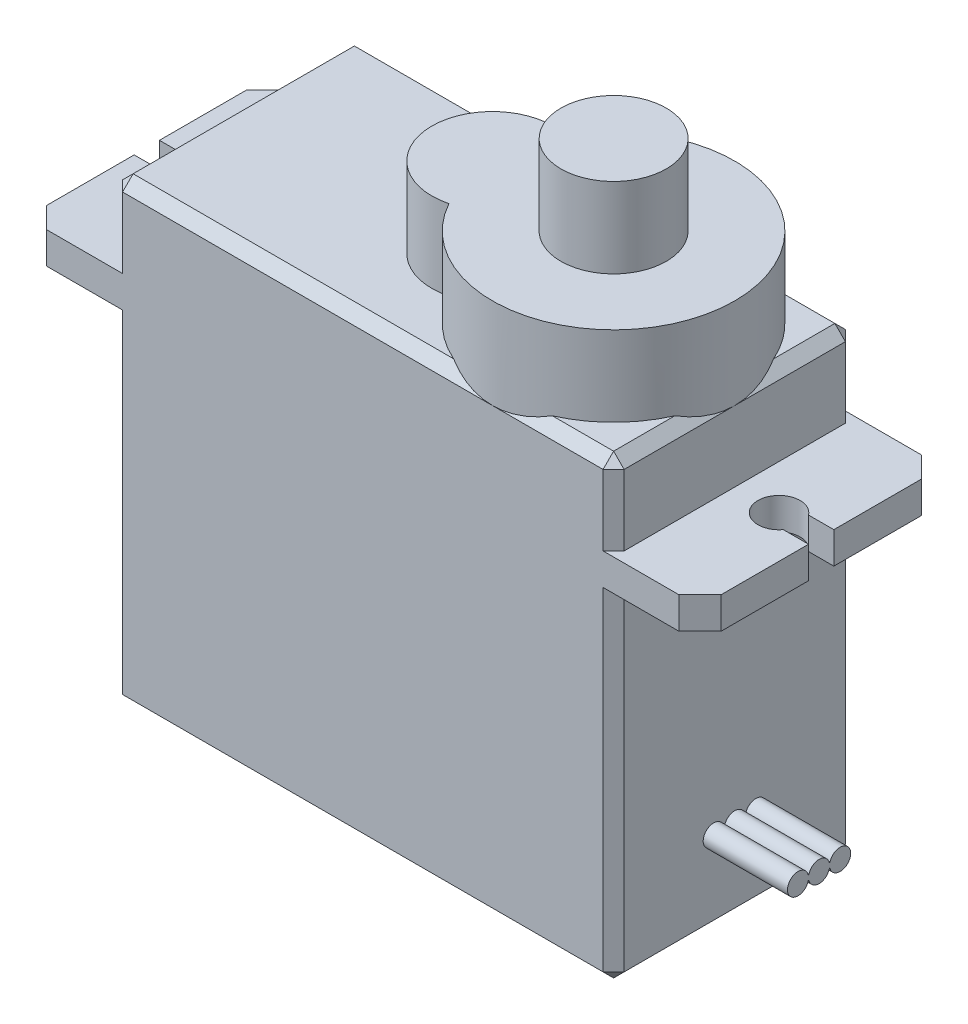
from build123d import *

# Parameters (mm, degrees)
SKETCH_1_W          = 23.8
SKETCH_1_H          = 21.65
SKETCH_1_W_2        = 32
SKETCH_1_H_2        = 1.5
EXTRUDE_1_DEPTH     = 11.5
SKETCH_2_R          = 1
SKETCH_2_W          = 1.2
SKETCH_2_H          = 1.2
CUT_EXTRUDE_1_DEPTH = 11.5
SKETCH_3_R          = 5.75
SKETCH_3_R_2        = 2.875
EXTRUDE_2_DEPTH     = 3.8
SKETCH_4_R          = 2.5
EXTRUDE_3_DEPTH     = 3.8
CHAMFER_1_SIZE      = 1
CHAMFER_2_SIZE      = 0.5
SKETCH_5_R          = 0.5
SKETCH_5_W          = 1.377901166
SKETCH_5_H          = 0.226119028
EXTRUDE_5_DEPTH     = 4


with BuildPart() as part:
    # Эскиз1 → Бобышка-Вытянуть1 (new body)
    with BuildSketch(Plane.XY):
        Rectangle(SKETCH_1_W, SKETCH_1_H)
        with Locations((0, 6.225)):
            Rectangle(SKETCH_1_W_2, SKETCH_1_H_2)
    extrude(amount=EXTRUDE_1_DEPTH)

    # Эскиз2 → Вырез-Вытянуть1 (cut)
    with BuildSketch(Plane(origin=(0, 6.975, 0), x_dir=(1, 0, 0), z_dir=(0, 1, 0))):
        with Locations((-14, -5.75)):
            Circle(SKETCH_2_R)
        with Locations((14, -5.75)):
            Circle(SKETCH_2_R)
        with Locations((-15.4, -5.75)):
            Rectangle(SKETCH_2_W, SKETCH_2_H)
        with Locations((15.4, -5.75)):
            Rectangle(SKETCH_2_W, SKETCH_2_H)
    extrude(amount=-CUT_EXTRUDE_1_DEPTH, mode=Mode.SUBTRACT)

    # Эскиз3 → Бобышка-Вытянуть2 (add)
    with BuildSketch(Plane(origin=(0, 10.825, 0), x_dir=(1, 0, 0), z_dir=(0, 1, 0))):
        with Locations((6.15, -5.75)):
            Circle(SKETCH_3_R)
        with Locations((0.4, -5.75)):
            Circle(SKETCH_3_R_2)
    extrude(amount=EXTRUDE_2_DEPTH)

    # Эскиз4 → Бобышка-Вытянуть3 (add)
    with BuildSketch(Plane(origin=(0, 14.625, 0), x_dir=(1, 0, 0), z_dir=(0, 1, 0))):
        with Locations(Location((6.15, -5.75, 0), (0, 0, 270))):
            Circle(SKETCH_4_R)
    extrude(amount=EXTRUDE_3_DEPTH)

    # Фаска1
    chamfer_1_edges = [part.edges().sort_by_distance(p)[0] for p in [
        (-16, 6.225, 11.5),
        (-16, 6.225, 0),
        (16, 6.225, 0),
        (16, 6.225, 11.5),
    ]]
    chamfer(chamfer_1_edges, length=CHAMFER_1_SIZE)

    # Фаска2
    # the kernel refuses this chamfer: 0.5 mm, written as the material it takes off along each edge
    with BuildSketch(Plane(origin=(11.566666667, -10.491666667, 0.333333333), x_dir=(0.7071067811865476, 0, 0.7071067811865475), z_dir=(0.5773502691896257, -0.5773502691896258, -0.5773502691896258)), Plane(origin=(-11.566666667, 10.491666667, 11.166666667), x_dir=(-0.7071067811865475, -0.7071067811865475, 0), z_dir=(-0.5773502691896258, 0.5773502691896258, 0.5773502691896258)), Plane(origin=(-11.566666667, -10.491666667, 0.333333333), x_dir=(0, -0.7071067811865476, 0.7071067811865475), z_dir=(-0.5773502691896257, -0.5773502691896257, -0.5773502691896258)), Plane(origin=(11.566666667, 10.491666667, 0.333333333), x_dir=(0, 0.7071067811865476, 0.7071067811865475), z_dir=(0.5773502691896257, 0.5773502691896257, -0.5773502691896258))) as chamfer_2_piece_1:
        Polygon((-0.353553391, -0.204124145), (0.353553391, -0.204124145), (0, 0.40824829), align=None)
    extrude(amount=0.635085296, mode=Mode.SUBTRACT)
    with BuildSketch(Plane(origin=(11.566666667, -10.491666667, 11.166666667), x_dir=(-0.7071067811865475, -0.7071067811865475, 0), z_dir=(0.5773502691896258, -0.5773502691896258, 0.5773502691896258)), Plane(origin=(11.566666667, 10.491666667, 11.166666667), x_dir=(0.7071067811865475, -0.7071067811865475, 0), z_dir=(0.5773502691896258, 0.5773502691896258, 0.5773502691896258)), Plane(origin=(-11.566666667, 10.491666667, 0.333333333), x_dir=(0, 0.7071067811865476, 0.7071067811865475), z_dir=(-0.5773502691896257, 0.5773502691896257, -0.5773502691896258)), Plane(origin=(-11.566666667, -10.491666667, 11.166666667), x_dir=(0, -0.7071067811865475, -0.7071067811865475), z_dir=(-0.5773502691896258, -0.5773502691896258, 0.5773502691896258))) as chamfer_2_piece_2:
        Polygon((-0.353553391, 0.204124145), (0.353553391, 0.204124145), (0, -0.40824829), align=None)
    extrude(amount=0.635085296, mode=Mode.SUBTRACT)
    with BuildSketch(Plane(origin=(11.9, -10.825, -1.285841494), x_dir=(0.027495876610585647, 0.9996219169112968, 0), z_dir=(0, 0, 1)), Plane(origin=(-11.9, -10.825, -1.285841494), x_dir=(0.9996219169112968, -0.027495876610585647, 0), z_dir=(0, 0, 1))) as chamfer_2_piece_3:
        Polygon((CHAMFER_2_SIZE * 0.999621916911, CHAMFER_2_SIZE * 0.0274958766106), (-CHAMFER_2_SIZE * 0.0274958766106, CHAMFER_2_SIZE * 0.999621916911), (0, 0), align=None)
    extrude(amount=14.071682988, mode=Mode.SUBTRACT)
    with BuildSketch(Plane(origin=(11.9, 10.825, 5.75), x_dir=(0.027495876610585647, -0.9996219169112968, 0), z_dir=(0, 0, 1))) as chamfer_2_piece_4_section:
        Polygon((CHAMFER_2_SIZE * 0.999621916911, -CHAMFER_2_SIZE * 0.0274958766106), (-CHAMFER_2_SIZE * 0.0274958766106, -CHAMFER_2_SIZE * 0.999621916911), (0, 0), align=None)
    chamfer_2_piece_4 = extrude(amount=7.035841494, mode=Mode.PRIVATE)
    chamfer_2_piece_4 = chamfer_2_piece_4 - Plane(origin=(6.15, 10.65169011, 5.75), x_dir=(1, 0, 0), z_dir=(0, -1, 0)) * Cylinder(5.75, 17, mode=Mode.PRIVATE)
    add(chamfer_2_piece_4, mode=Mode.SUBTRACT)
    with BuildSketch(Plane(origin=(-11.9, 10.825, -1.285841494), x_dir=(0.9996219169112968, 0.027495876610585647, 0), z_dir=(0, 0, 1))) as chamfer_2_piece_5:
        Polygon((CHAMFER_2_SIZE * 0.999621916911, -CHAMFER_2_SIZE * 0.0274958766106), (-CHAMFER_2_SIZE * 0.0274958766106, -CHAMFER_2_SIZE * 0.999621916911), (0, 0), align=None)
    extrude(amount=14.071682988, mode=Mode.SUBTRACT)
    with BuildSketch(Plane(origin=(-11.9, 5.475, 11.5), x_dir=(-0.027495876610585647, 0, -0.9996219169112968), z_dir=(0, -1, 0)), Plane(origin=(11.9, -12.110841494, 11.5), x_dir=(0.027495876610585647, 0, -0.9996219169112968), z_dir=(0, 1, 0)), Plane(origin=(-11.9, 5.475, 0), x_dir=(0.9996219169112968, 0, -0.02749587661058639), z_dir=(0, -1, 0)), Plane(origin=(11.9, -12.110841494, 0), x_dir=(-0.9996219169112968, 0, -0.02749587661058639), z_dir=(0, 1, 0))) as chamfer_2_piece_6:
        Polygon((CHAMFER_2_SIZE * 0.999621916911, CHAMFER_2_SIZE * 0.0274958766106), (-CHAMFER_2_SIZE * 0.0274958766106, CHAMFER_2_SIZE * 0.999621916911), (0, 0), align=None)
    extrude(amount=17.585841494, mode=Mode.SUBTRACT)
    with BuildSketch(Plane(origin=(-11.9, 12.110841494, 11.5), x_dir=(-0.027495876610585647, 0, -0.9996219169112968), z_dir=(0, -1, 0)), Plane(origin=(11.9, 6.975, 11.5), x_dir=(0.027495876610585647, 0, -0.9996219169112968), z_dir=(0, 1, 0)), Plane(origin=(-11.9, 12.110841494, 0), x_dir=(0.9996219169112968, 0, -0.02749587661058639), z_dir=(0, -1, 0)), Plane(origin=(11.9, 6.975, 0), x_dir=(-0.9996219169112968, 0, -0.02749587661058639), z_dir=(0, 1, 0))) as chamfer_2_piece_7:
        Polygon((CHAMFER_2_SIZE * 0.999621916911, CHAMFER_2_SIZE * 0.0274958766106), (-CHAMFER_2_SIZE * 0.0274958766106, CHAMFER_2_SIZE * 0.999621916911), (0, 0), align=None)
    extrude(amount=5.135841494, mode=Mode.SUBTRACT)
    with BuildSketch(Plane(origin=(6.15, 10.825, 11.5), x_dir=(0, 0.027495876610585647, -0.9996219169112968), z_dir=(-1, 0, 0))) as chamfer_2_piece_8_section:
        Polygon((CHAMFER_2_SIZE * 0.999621916911, CHAMFER_2_SIZE * 0.0274958766106), (-CHAMFER_2_SIZE * 0.0274958766106, CHAMFER_2_SIZE * 0.999621916911), (0, 0), align=None)
    chamfer_2_piece_8 = extrude(amount=19.335841494, mode=Mode.PRIVATE)
    chamfer_2_piece_8 = chamfer_2_piece_8 - Plane(origin=(6.15, 10.656558796, 5.75), x_dir=(1, 0, 0), z_dir=(0, -1, 0)) * Cylinder(5.75, 41, mode=Mode.PRIVATE)
    add(chamfer_2_piece_8, mode=Mode.SUBTRACT)
    with BuildSketch(Plane(origin=(-13.185841494, -10.825, 11.5), x_dir=(0, -0.027495876610585647, -0.9996219169112968), z_dir=(1, 0, 0)), Plane(origin=(-13.185841494, -10.825, 0), x_dir=(0, 0.9996219169112968, -0.02749587661058639), z_dir=(1, 0, 0))) as chamfer_2_piece_9:
        Polygon((CHAMFER_2_SIZE * 0.999621916911, CHAMFER_2_SIZE * 0.0274958766106), (-CHAMFER_2_SIZE * 0.0274958766106, CHAMFER_2_SIZE * 0.999621916911), (0, 0), align=None)
    extrude(amount=26.371682988, mode=Mode.SUBTRACT)
    with BuildSketch(Plane(origin=(6.150000032, 10.825, 0), x_dir=(0, -0.9996219169112968, -0.02749587661058639), z_dir=(-1, 0, 0))) as chamfer_2_piece_10_section:
        Polygon((CHAMFER_2_SIZE * 0.999621916911, CHAMFER_2_SIZE * 0.0274958766106), (-CHAMFER_2_SIZE * 0.0274958766106, CHAMFER_2_SIZE * 0.999621916911), (0, 0), align=None)
    chamfer_2_piece_10 = extrude(amount=19.335841526, mode=Mode.PRIVATE)
    chamfer_2_piece_10 = chamfer_2_piece_10 - Plane(origin=(6.15, 10.656558796, 5.75), x_dir=(1, 0, 0), z_dir=(0, -1, 0)) * Cylinder(5.75, 41, mode=Mode.PRIVATE)
    add(chamfer_2_piece_10, mode=Mode.SUBTRACT)
    with BuildSketch(Plane(origin=(13.185841494, 10.825, 0), x_dir=(0, -0.9996219169112968, -0.02749587661058639), z_dir=(-1, 0, 0))) as chamfer_2_piece_11_section:
        Polygon((CHAMFER_2_SIZE * 0.999621916911, CHAMFER_2_SIZE * 0.0274958766106), (-CHAMFER_2_SIZE * 0.0274958766106, CHAMFER_2_SIZE * 0.999621916911), (0, 0), align=None)
    chamfer_2_piece_11 = extrude(amount=7.035841462, mode=Mode.PRIVATE)
    chamfer_2_piece_11 = chamfer_2_piece_11 - Plane(origin=(6.15, 10.65169011, 5.75), x_dir=(1, 0, 0), z_dir=(0, -1, 0)) * Cylinder(5.75, 17, mode=Mode.PRIVATE)
    add(chamfer_2_piece_11, mode=Mode.SUBTRACT)
    with BuildSketch(Plane(origin=(13.185841494, 10.825, 11.5), x_dir=(0, -0.9996219169112968, 0.027495876610585647), z_dir=(-1, 0, 0))) as chamfer_2_piece_12_section:
        Polygon((CHAMFER_2_SIZE * 0.999621916911, -CHAMFER_2_SIZE * 0.0274958766106), (-CHAMFER_2_SIZE * 0.0274958766106, -CHAMFER_2_SIZE * 0.999621916911), (0, 0), align=None)
    chamfer_2_piece_12 = extrude(amount=7.035841494, mode=Mode.PRIVATE)
    chamfer_2_piece_12 = chamfer_2_piece_12 - Plane(origin=(6.15, 10.65169011, 5.75), x_dir=(1, 0, 0), z_dir=(0, -1, 0)) * Cylinder(5.75, 17, mode=Mode.PRIVATE)
    add(chamfer_2_piece_12, mode=Mode.SUBTRACT)
    with BuildSketch(Plane(origin=(11.9, 10.825, -1.285841494), x_dir=(0.027495876610585647, -0.9996219169112968, 0), z_dir=(0, 0, 1))) as chamfer_2_piece_13_section:
        Polygon((CHAMFER_2_SIZE * 0.999621916911, -CHAMFER_2_SIZE * 0.0274958766106), (-CHAMFER_2_SIZE * 0.0274958766106, -CHAMFER_2_SIZE * 0.999621916911), (0, 0), align=None)
    chamfer_2_piece_13 = extrude(amount=7.035841494, mode=Mode.PRIVATE)
    chamfer_2_piece_13 = chamfer_2_piece_13 - Plane(origin=(6.15, 10.65169011, 5.75), x_dir=(1, 0, 0), z_dir=(0, -1, 0)) * Cylinder(5.75, 17, mode=Mode.PRIVATE)
    add(chamfer_2_piece_13, mode=Mode.SUBTRACT)

    # Эскиз5 → Бобышка-Вытянуть5 (add)
    with BuildSketch(Plane(origin=(11.9, 0, 0), x_dir=(0, 0, -1), z_dir=(1, 0, 0))):
        with Locations((-5.75, -6.825)):
            Circle(SKETCH_5_R)
        with Locations((-4.75, -6.825)):
            Circle(SKETCH_5_R)
        with Locations((-6.75, -6.825)):
            Circle(SKETCH_5_R)
        with Locations((-5.75, -6.825)):
            Rectangle(SKETCH_5_W, SKETCH_5_H)
    extrude(amount=EXTRUDE_5_DEPTH)


solid = part.part
